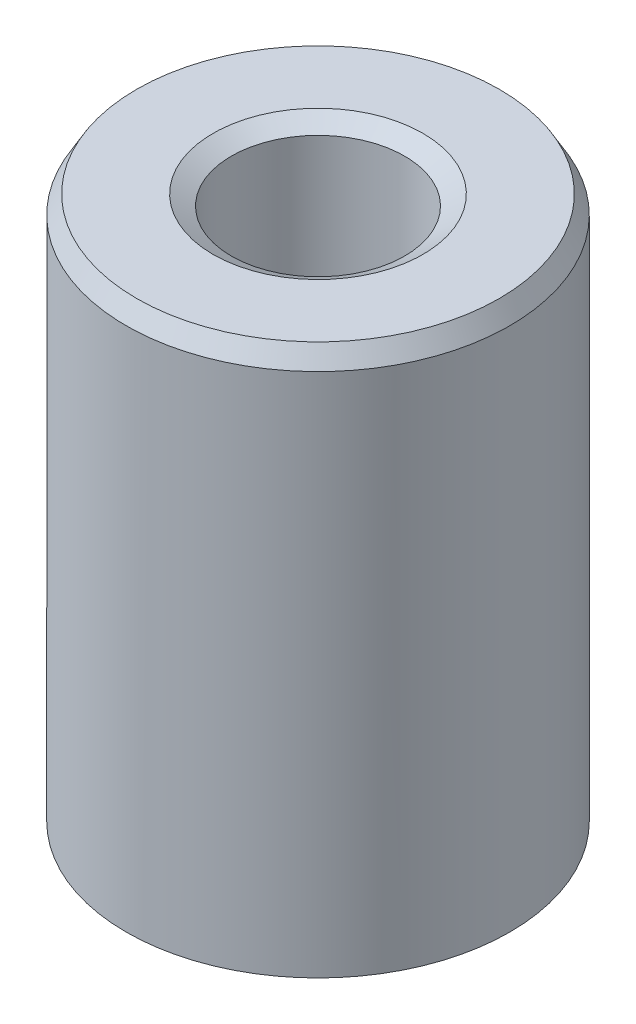
from build123d import *
from OCP.BRepFilletAPI import BRepFilletAPI_MakeChamfer

# Parameters (mm, degrees)
SKETCH1_R           = 17.5
BOSS_EXTRUDE1_DEPTH = 50.535799202
SKETCH2_R           = 7.904021258
CUT_EXTRUDE1_DEPTH  = 57.270480724
CHAMFER1_SIZE       = 1.667486549
CHAMFER1_SIZE2      = 0.962723808


with BuildPart() as part:
    # Sketch1 → Boss-Extrude1 (new body)
    with BuildSketch(Plane(origin=(0, 0, 0), x_dir=(1, 0, 0), z_dir=(0, 1, 0))):
        Circle(SKETCH1_R)
    extrude(amount=BOSS_EXTRUDE1_DEPTH)

    # Sketch2 → Cut-Extrude1 (cut, through all)
    with BuildSketch(Plane(origin=(0, 0, 0), x_dir=(1, 0, 0), z_dir=(0, 1, 0))):
        Circle(SKETCH2_R)
    extrude(amount=CUT_EXTRUDE1_DEPTH, mode=Mode.SUBTRACT)

    # Chamfer1: one chamfer whose edges measure the first distance from different faces: ONE call of the kernel's chamfer builder (chamfer() names one face for all edges)
    chamfer1_edges_1 = [part.edges().sort_by_distance(p)[0] for p in [
        (-7.904021258, 50.535799202, 0),
    ]]
    chamfer1_side_1 = [part.faces().sort_by_distance(p)[0] for p in [
        (-17.005025253, 50.535799202, 0),
    ]]
    chamfer1_edges_2 = [part.edges().sort_by_distance(p)[0] for p in [
        (-7.904021258, 0, 0),
    ]]
    chamfer1_side_2 = [part.faces().sort_by_distance(p)[0] for p in [
        (-7.904021258, 25.267899601, 0),
    ]]
    chamfer1_edges_3 = [part.edges().sort_by_distance(p)[0] for p in [
        (-17.5, 0, 0),
    ]]
    chamfer1_side_3 = [part.faces().sort_by_distance(p)[0] for p in [
        (-17.005025253, 0, 0),
    ]]
    chamfer1_edges_4 = [part.edges().sort_by_distance(p)[0] for p in [
        (-17.5, 50.535799202, 0),
    ]]
    chamfer1_side_4 = [part.faces().sort_by_distance(p)[0] for p in [
        (-17.5, 25.267899601, 0),
    ]]
    chamfer1 = BRepFilletAPI_MakeChamfer(part.part.solid().wrapped)
    for e in chamfer1_edges_1:
        chamfer1.Add(CHAMFER1_SIZE, CHAMFER1_SIZE2, e.wrapped, chamfer1_side_1[0].wrapped)  # the first distance lies on this face
    for e in chamfer1_edges_2:
        chamfer1.Add(CHAMFER1_SIZE, CHAMFER1_SIZE2, e.wrapped, chamfer1_side_2[0].wrapped)  # the first distance lies on this face
    for e in chamfer1_edges_3:
        chamfer1.Add(CHAMFER1_SIZE, CHAMFER1_SIZE2, e.wrapped, chamfer1_side_3[0].wrapped)  # the first distance lies on this face
    for e in chamfer1_edges_4:
        chamfer1.Add(CHAMFER1_SIZE, CHAMFER1_SIZE2, e.wrapped, chamfer1_side_4[0].wrapped)  # the first distance lies on this face
    add(Compound.cast(chamfer1.Shape()), mode=Mode.REPLACE)


solid = part.part
